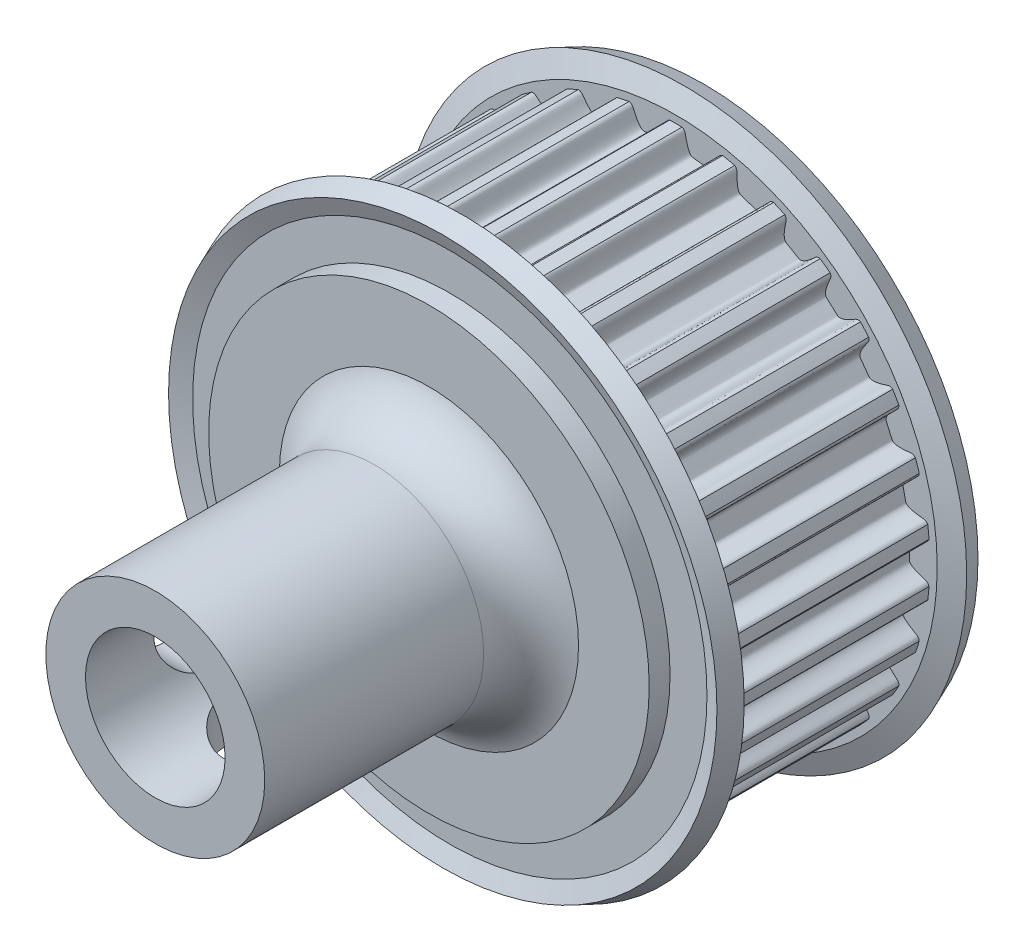
from build123d import *

# Parameters (mm, degrees)
TOOTHEXTRUDECUTGEARBELT01_DEPTH = 3.749999944
TOOTH_PATTERN_30_COUNT          = 30
BOREREVOLVESKETCH_W             = 10.547999842
BOREREVOLVESKETCH_H             = 5
SKETCH_5_R                      = 5
EXTRUDE_1_DEPTH                 = 11
SKETCH_6_R                      = 4
SKETCH_6_R_2                    = 2.55
EXTRUDE_2_DEPTH                 = 10
CUT_EXTRUDE_2_REACH             = 23.117
CUT_EXTRUDE_3_REACH             = 23.117
CUT_EXTRUDE_4_REACH             = 20.266
SKETCH_10_R                     = 2.55
CUT_EXTRUDE_START               = -1
SKETCH_11_R                     = 8.049296465
CUT_EXTRUDE_5_DEPTH             = 1


with BuildPart() as part:
    # SketchRevolveGearBelt01 → Gates_PowerGrip_GT_2mm, 6mm Belt Width (revolve)
    with BuildSketch(Plane(origin=(0, 0, 0), x_dir=(0, 0, -1), z_dir=(1, 0, 0))):
        Polygon((5.273999921, 0), (5.273999921, 8.049296465), (4.511999932, 8.049296465), (4.511999932, 9.39772522), (4.769626867, 10.01969166), (4.065630673, 10.311296431), (3.749999944, 9.549296442), (3.749999944, 9.280480626), (-3.749999944, 9.280480626), (-3.749999944, 9.549296442), (-4.065630673, 10.311296431), (-4.769626867, 10.01969166), (-4.511999932, 9.39772522), (-4.511999932, 8.049296465), (-5.273999921, 8.049296465), (-5.273999921, 0), align=None)
    revolve(axis=Axis((0, 0, 0), (0, 0, -1)))

    # SketchToothGearBelt01 → ToothExtrudeCutGearBelt01 (cut, symmetric)
    with BuildSketch(Plane.XY):
        with BuildLine():
            ThreePointArc((9.259469869, 0.812097889), (9.295013999, 0), (9.259469869, -0.812097889))
            add(Edge.make_bspline(
                [(9.259469869, -0.812097889), (9.259882643, -0.798926426), (9.258535745, -0.779109129), (9.252881928, -0.753334284), (9.246755053, -0.734515852), (9.238801169, -0.716393821), (9.229098, -0.699145002), (9.217740163, -0.682937939), (9.204838756, -0.667930081), (9.190518793, -0.65427062), (9.174923394, -0.642082736), (9.158192233, -0.631523205), (9.140535394, -0.622553924), (9.096806178, -0.606636992), (9.040654354, -0.589254035), (8.974000339, -0.567478509), (8.923234955, -0.549822047), (8.875536871, -0.532182767), (8.830912224, -0.514541632), (8.789358436, -0.496903406), (8.750874778, -0.479266882), (8.715459684, -0.46163211), (8.68311132, -0.443998471), (8.653827322, -0.426364888), (8.627604868, -0.408729361), (8.604440496, -0.39108843), (8.584331378, -0.373436343), (8.567273563, -0.355764081), (8.553273739, -0.338058507), (8.542322401, -0.320303478), (8.534501566, -0.302483729), (8.529637264, -0.284599108), (8.527464323, -0.250294946), (8.531227193, -0.199977901), (8.531655597, -0.133284358), (8.532656984, -0.066646885), (8.532835685, 0), (8.532656984, 0.066646885), (8.531655597, 0.133284358), (8.531227193, 0.199977901), (8.527464323, 0.250294946), (8.529637264, 0.284599108), (8.534501566, 0.302483729), (8.542322401, 0.320303478), (8.553273739, 0.338058507), (8.567273563, 0.355764081), (8.584331378, 0.373436343), (8.604440496, 0.39108843), (8.627604868, 0.408729361), (8.653827322, 0.426364888), (8.68311132, 0.443998471), (8.715459684, 0.46163211), (8.750874778, 0.479266882), (8.789358436, 0.496903406), (8.830912224, 0.514541632), (8.875536871, 0.532182767), (8.923234955, 0.549822047), (8.974000339, 0.567478509), (9.040654354, 0.589254035), (9.096806178, 0.606636992), (9.140535394, 0.622553924), (9.158192233, 0.631523205), (9.174923394, 0.642082736), (9.190518793, 0.65427062), (9.204838756, 0.667930081), (9.217740163, 0.682937939), (9.229098, 0.699145002), (9.238801169, 0.716393821), (9.246755053, 0.734515852), (9.252881928, 0.753334284), (9.258535745, 0.779109129), (9.259882643, 0.798926426), (9.259469869, 0.812097889)],
                knots=[0, 0, 0, 0, 0.015923832, 0.023885748, 0.031847664, 0.039809581, 0.047771497, 0.055733413, 0.063695329, 0.071657245, 0.079619161, 0.087581077, 0.095542993, 0.10350491, 0.143783134, 0.166612007, 0.18826668, 0.208754844, 0.228085578, 0.246269698, 0.263320202, 0.279252862, 0.294087016, 0.307846634, 0.320561765, 0.332270503, 0.343021643, 0.352878214, 0.361921967, 0.370258601, 0.378022746, 0.385380527, 0.392526466, 0.419432991, 0.44628866, 0.47314433, 0.5, 0.52685567, 0.55371134, 0.580567009, 0.607473534, 0.614619473, 0.621977254, 0.629741399, 0.638078033, 0.647121786, 0.656978357, 0.667729497, 0.679438235, 0.692153366, 0.705912984, 0.720747138, 0.736679798, 0.753730302, 0.771914422, 0.791245156, 0.81173332, 0.833387993, 0.856216866, 0.89649509, 0.904457007, 0.912418923, 0.920380839, 0.928342755, 0.936304671, 0.944266587, 0.952228503, 0.960190419, 0.968152336, 0.976114252, 0.984076168, 1, 1, 1, 1], degree=3))
        make_face()
    toothextrudecutgearbelt01 = extrude(amount=TOOTHEXTRUDECUTGEARBELT01_DEPTH, both=True, mode=Mode.SUBTRACT)

    # Tooth Pattern, 30: ToothExtrudeCutGearBelt01 ×30 about axis
    tooth_pattern_30_axis = Axis((0, 0, 55), (0, 0, -1))
    for i in range(1, TOOTH_PATTERN_30_COUNT):
        add(toothextrudecutgearbelt01.rotate(tooth_pattern_30_axis, i * 360 / TOOTH_PATTERN_30_COUNT), mode=Mode.SUBTRACT)

    # BoreRevolveSketch → BoreRevolveCut (revolve, cut)
    with BuildSketch(Plane(origin=(0, 0, 0), x_dir=(0, 0, -1), z_dir=(1, 0, 0))):
        with Locations((0, 2.5)):
            Rectangle(BOREREVOLVESKETCH_W, BOREREVOLVESKETCH_H)
    revolve(axis=Axis((0, 0, 0), (0, 0, -1)), mode=Mode.SUBTRACT)

    # 草图5 → 凸台-拉伸1 (add)
    with BuildSketch(Plane.XY.offset(5.273999921)):
        Circle(SKETCH_5_R)
    extrude(amount=-EXTRUDE_1_DEPTH)

    # 草图6 → 凸台-拉伸2 (add)
    with BuildSketch(Plane.XY.offset(5.273999921)):
        Circle(SKETCH_6_R)
        Circle(SKETCH_6_R_2, mode=Mode.SUBTRACT)
    extrude(amount=EXTRUDE_2_DEPTH)

    # 草图7 → 旋转2 (revolve)
    with BuildSketch(Plane(origin=(0, 0, 0), x_dir=(1, 0, 0), z_dir=(0, 1, 0))):
        with BuildLine():
            Line((-4, -5.273999921), (-4, -7.273999921))
            ThreePointArc((-4, -7.273999921), (-4.40592017, -6.03396768), (-5.466533271, -5.273999921))
            Line((-5.466533271, -5.273999921), (-4, -5.273999921))
        make_face()
    revolve(axis=Axis((0, 0, 55), (0, 0, -1)))

    # 草图8 → 切除-拉伸2 (cut, up to next)
    with BuildSketch(Plane(origin=(0, 0, 0), x_dir=(1, 0, 0), z_dir=(0, 1, 0)), mode=Mode.PRIVATE) as cut_extrude_2_sk1:
        with BuildLine():
            ThreePointArc((0, -12.773999921), (1.060660172, -12.334660093), (1.5, -11.273999921))
            ThreePointArc((1.5, -11.273999921), (-1.060660172, -10.213339749), (0, -12.773999921))
        make_face()
    cut_extrude_2_tool1 = extrude(cut_extrude_2_sk1.sketch, amount=-CUT_EXTRUDE_2_REACH, mode=Mode.PRIVATE) & part.part
    add(cut_extrude_2_tool1.solids().sort_by_distance((0, 0, 11.274))[0], mode=Mode.SUBTRACT)

    # 草图9 → 切除-拉伸3 (cut, up to next)
    with BuildSketch(Plane(origin=(0, 0, 0), x_dir=(0, 0, -1), z_dir=(1, 0, 0)), mode=Mode.PRIVATE) as cut_extrude_3_sk1:
        with BuildLine():
            ThreePointArc((-12.773999921, 0), (-11.273999921, -1.5), (-9.773999921, 0))
            ThreePointArc((-9.773999921, 0), (-11.273999921, 1.5), (-12.773999921, 0))
        make_face()
    cut_extrude_3_tool1 = extrude(cut_extrude_3_sk1.sketch, amount=-CUT_EXTRUDE_3_REACH, mode=Mode.PRIVATE) & part.part
    add(cut_extrude_3_tool1.solids().sort_by_distance((0, 0, 11.274))[0], mode=Mode.SUBTRACT)

    # 草图10 → 切除-拉伸4 (cut, up to next)
    with BuildSketch(Plane.XY.offset(5.273999921), mode=Mode.PRIVATE) as cut_extrude_4_sk1:
        Circle(SKETCH_10_R)
    cut_extrude_4_tool1 = extrude(cut_extrude_4_sk1.sketch, amount=-CUT_EXTRUDE_4_REACH, mode=Mode.PRIVATE) & part.part
    add(cut_extrude_4_tool1.solids().sort_by_distance((0, 0, 5.274))[0], mode=Mode.SUBTRACT)

    # 草图11 → 切除-拉伸5 (cut)
    with BuildSketch(Plane(origin=(0, 0, -5.726000079), x_dir=(-1, 0, 0), z_dir=(0, 0, -1)).offset(CUT_EXTRUDE_START)):
        Circle(SKETCH_11_R)
    extrude(amount=CUT_EXTRUDE_5_DEPTH, mode=Mode.SUBTRACT)


solid = part.part
